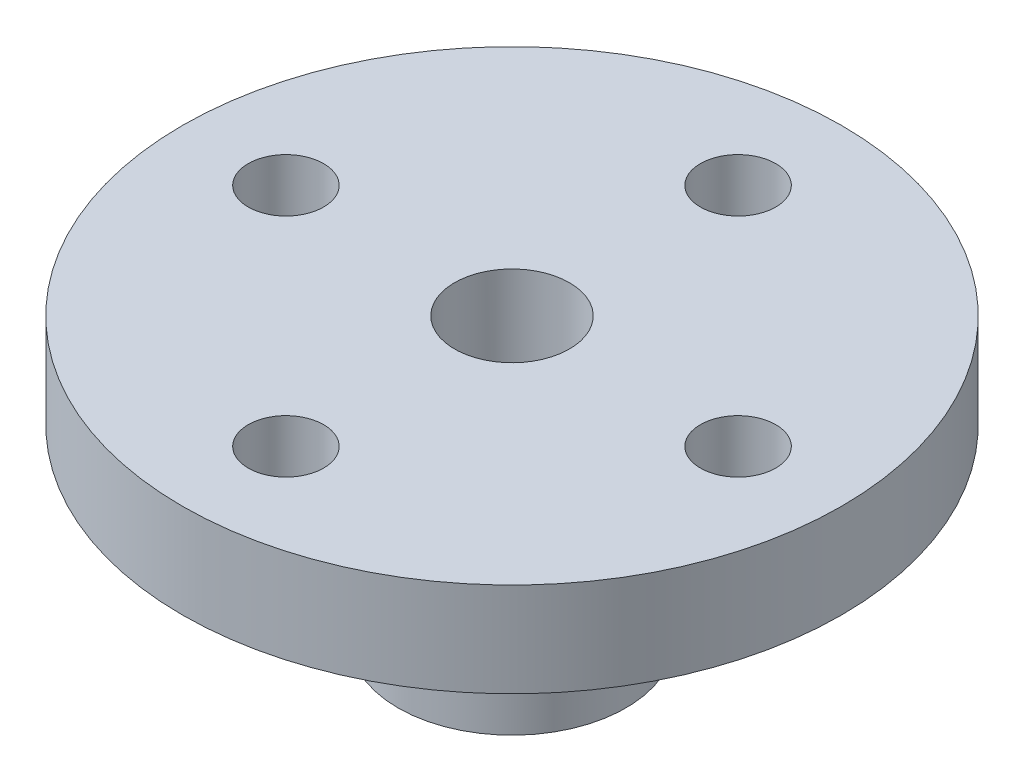
from build123d import *

# Parameters (mm, degrees)
SKETCH1_R               = 6.05
SKETCH1_R_2             = 3.05
BOSS_EXTRUDE1_DEPTH     = 10
SKETCH2_R               = 17.5
BOSS_EXTRUDE2_DEPTH     = 5
SKETCH3_R               = 2
CUT_EXTRUDE1_DEPTH      = 5
CUT_EXTRUDE2_DEPTH      = 29.939592257
CUT_EXTRUDE2_DEPTH_BACK = 29.939592257
SKETCH4_R               = 1.5
SKETCH6_R               = 3.05
CUT_EXTRUDE3_DEPTH      = 5


with BuildPart() as part:
    # Sketch1 → Boss-Extrude1 (new body)
    with BuildSketch(Plane(origin=(0, 0, 0), x_dir=(1, 0, 0), z_dir=(0, 1, 0))):
        Circle(SKETCH1_R)
        Circle(SKETCH1_R_2, mode=Mode.SUBTRACT)
    extrude(amount=BOSS_EXTRUDE1_DEPTH)

    # Sketch2 → Boss-Extrude2 (add)
    with BuildSketch(Plane(origin=(0, 10, 0), x_dir=(1, 0, 0), z_dir=(0, 1, 0))):
        Circle(SKETCH2_R)
    extrude(amount=BOSS_EXTRUDE2_DEPTH)

    # Sketch3 → Cut-Extrude1 (cut)
    with BuildSketch(Plane.XZ.offset(-10)):
        with Locations((12, 0)):
            Circle(SKETCH3_R)
        with Locations((0, -12)):
            Circle(SKETCH3_R)
        with Locations((-12, 0)):
            Circle(SKETCH3_R)
        with Locations((0, 12)):
            Circle(SKETCH3_R)
    extrude(amount=-CUT_EXTRUDE1_DEPTH, mode=Mode.SUBTRACT)

    # Sketch4 → Cut-Extrude2 (cut, two sides: drawn at the far end of the back side and taken through both)
    with BuildSketch(Plane(origin=(0, 0, 0), x_dir=(0, 0, -1), z_dir=(1, 0, 0)).offset(-CUT_EXTRUDE2_DEPTH_BACK)):
        with Locations((0, 4.916404418)):
            Circle(SKETCH4_R)
    extrude(amount=CUT_EXTRUDE2_DEPTH + CUT_EXTRUDE2_DEPTH_BACK, mode=Mode.SUBTRACT)

    # Sketch6 → Cut-Extrude3 (cut)
    with BuildSketch(Plane(origin=(0, 10, 0), x_dir=(-1, 0, 0), z_dir=(0, -1, 0))):
        Circle(SKETCH6_R)
    extrude(amount=-CUT_EXTRUDE3_DEPTH, mode=Mode.SUBTRACT)


solid = part.part
